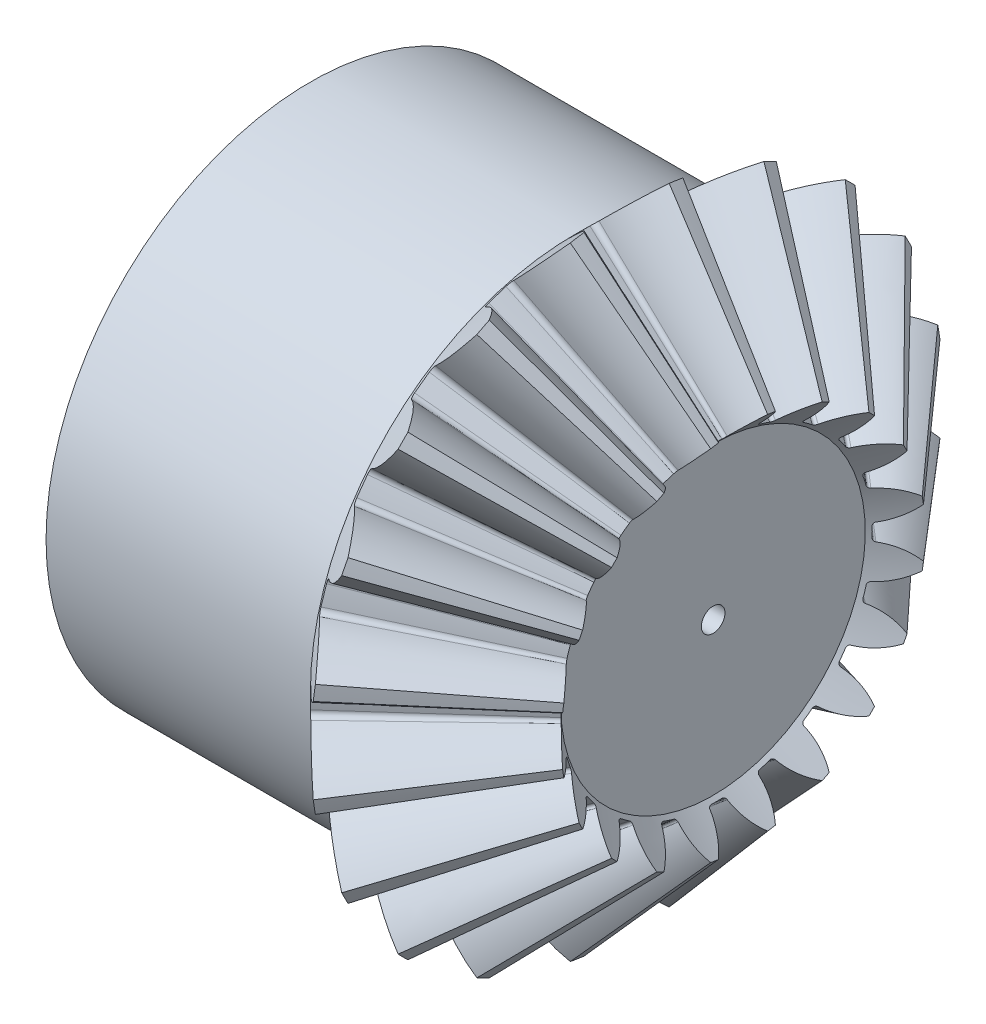
from build123d import *

# Parameters (mm, degrees)
TEETHCUTS_COUNT = 20
TEETHCUTS_ANGLE = 342
HUBSKE_R        = 8.949062546
HUB_DEPTH       = 8.949164146
BORSKE_R        = 0.4
BORE_DEPTH      = 20.0000508


with BuildPart() as part:
    # BasProSke → Base-Revolve (revolve)
    with BuildSketch(Plane(origin=(0, 0, 0), x_dir=(1, 0, 0), z_dir=(0, 1, 0)), mode=Mode.PRIVATE) as base_revolve_sk:
        Polygon((0, 0), (0, 8.949062547), (1.758044236, 10.707106781), (5.700684919, 6.16446609), (4.688515684, 5.152296856), (4.688515684, 0), align=None)
    revolve(base_revolve_sk.sketch.rotate(Axis((-10, 0, 0), (1, 0, 0)), 180), axis=Axis((-10, 0, 0), (1, 0, 0)))

    # ToothCut: read off the stored shape, not the designer's step
    # ToothCut: loft between two sections, ruled curve by curve
    toothcut_from = [
        Edge.make_bspline([(11.056978059, 0.006040604, -0.009397446), (11.052757644, 0.001820189, -0.014823153), (11.047082221, -0.003855234, -0.014022361), (11.043703013, -0.007234441, -0.007524359)], [0, 0, 0, 0, 1, 1, 1, 1], 3, [1, 0.779680287, 0.779680287, 1]),
        Edge.make_bspline([(11.043703013, -0.007234441, 0.007524359), (11.047082221, -0.003855234, 0.014022361), (11.052757644, 0.001820189, 0.014823153), (11.056978059, 0.006040604, 0.009397446)], [0, 0, 0, 0, 1, 1, 1, 1], 3, [1, 0.779680287, 0.779680287, 1]),
        Edge.make_bspline([(11.043703013, -0.007234441, -0.007524359), (11.043200956, -0.007736499, -0.006558934), (11.042799872, -0.008137583, -0.005503268), (11.04250773, -0.008429724, -0.004378334)], [0, 0, 0, 0, 1, 1, 1, 1], 3, [1, 0.993377071, 0.993377071, 1]),
        Edge.make_bspline([(11.04250773, -0.008429724, 0.004378334), (11.042799872, -0.008137583, 0.005503268), (11.043200956, -0.007736499, 0.006558934), (11.043703013, -0.007234441, 0.007524359)], [0, 0, 0, 0, 1, 1, 1, 1], 3, [1, 0.993377071, 0.993377071, 1]),
        Edge.make_bspline([(11.04250773, -0.008429724, -0.004378334), (11.041765856, -0.009171599, -0.001521635), (11.041765856, -0.009171599, 0.001521635), (11.04250773, -0.008429724, 0.004378334)], [0, 0, 0, 0, 1, 1, 1, 1], 3, [1, 0.959129516, 0.959129516, 1]),
        Edge.make_line((11.056978059, 0.006040604, 0.009397446), (11.056978059, 0.006040604, -0.009397446)),
    ]
    toothcut_to = [
        Edge.make_bspline([(1.831702175, 10.780764719, -1.608058394), (1.416177176, 10.365239721, -1.022568098), (0.895186141, 9.844248687, -0.641441323), (0.317192874, 9.266255421, -0.500131372)], [0, 0, 0, 0, 1, 1, 1, 1], 3, [1, 0.968992554, 0.968992554, 1]),
        Edge.make_bspline([(0.317192874, 9.266255421, 0.500131372), (0.895186141, 9.844248687, 0.641441323), (1.416177176, 10.365239721, 1.022568098), (1.831702175, 10.780764719, 1.608058394)], [0, 0, 0, 0, 1, 1, 1, 1], 3, [1, 0.968992554, 0.968992554, 1]),
        Edge.make_bspline([(0.317192874, 9.266255421, -0.500131372), (0.248143517, 9.197206064, -0.483249928), (0.20395306, 9.153015607, -0.406340777), (0.206397022, 9.155459569, -0.307302074)], [0, 0, 0, 0, 1, 1, 1, 1], 3, [1, 0.835744927, 0.835744927, 1]),
        Edge.make_bspline([(0.206397022, 9.155459569, 0.307302074), (0.20395306, 9.153015607, 0.406340777), (0.248143517, 9.197206064, 0.483249928), (0.317192874, 9.266255421, 0.500131372)], [0, 0, 0, 0, 1, 1, 1, 1], 3, [1, 0.835744927, 0.835744927, 1]),
        Edge.make_bspline([(0.206397022, 9.155459569, -0.307302074), (0.211451493, 9.16051404, -0.102475588), (0.211451493, 9.16051404, 0.102475588), (0.206397022, 9.155459569, 0.307302074)], [0, 0, 0, 0, 1, 1, 1, 1], 3, [1, 0.999594406, 0.999594406, 1]),
        Edge.make_line((1.831702175, 10.780764719, 1.608058394), (1.831702175, 10.780764719, -1.608058394)),
    ]
    toothcut = Solid(Shell([*[Face.make_surface_from_curves(toothcut_from[k], toothcut_to[k]) for k in range(6)], Face(Wire(toothcut_from)), Face(Wire(toothcut_to))]))
    add(toothcut, mode=Mode.SUBTRACT)

    # TeethCuts: ToothCut ×20 about axis
    teethcuts_axis = Axis((-10, 0, 0), (1, 0, 0))
    for i in range(1, TEETHCUTS_COUNT):
        add(toothcut.rotate(teethcuts_axis, i * TEETHCUTS_ANGLE / (TEETHCUTS_COUNT - 1)), mode=Mode.SUBTRACT)

    # HubSke → Hub (add)
    with BuildSketch(Plane.ZY):
        Circle(HUBSKE_R)
    extrude(amount=HUB_DEPTH)

    # BorSke → Bore (cut, symmetric)
    with BuildSketch(Plane(origin=(0, 0, 0), x_dir=(0, 0, -1), z_dir=(1, 0, 0))):
        with Locations(Location((0, 0, 0), (0, 0, 180))):
            Circle(BORSKE_R)
    extrude(amount=BORE_DEPTH, both=True, mode=Mode.SUBTRACT)


solid = part.part
